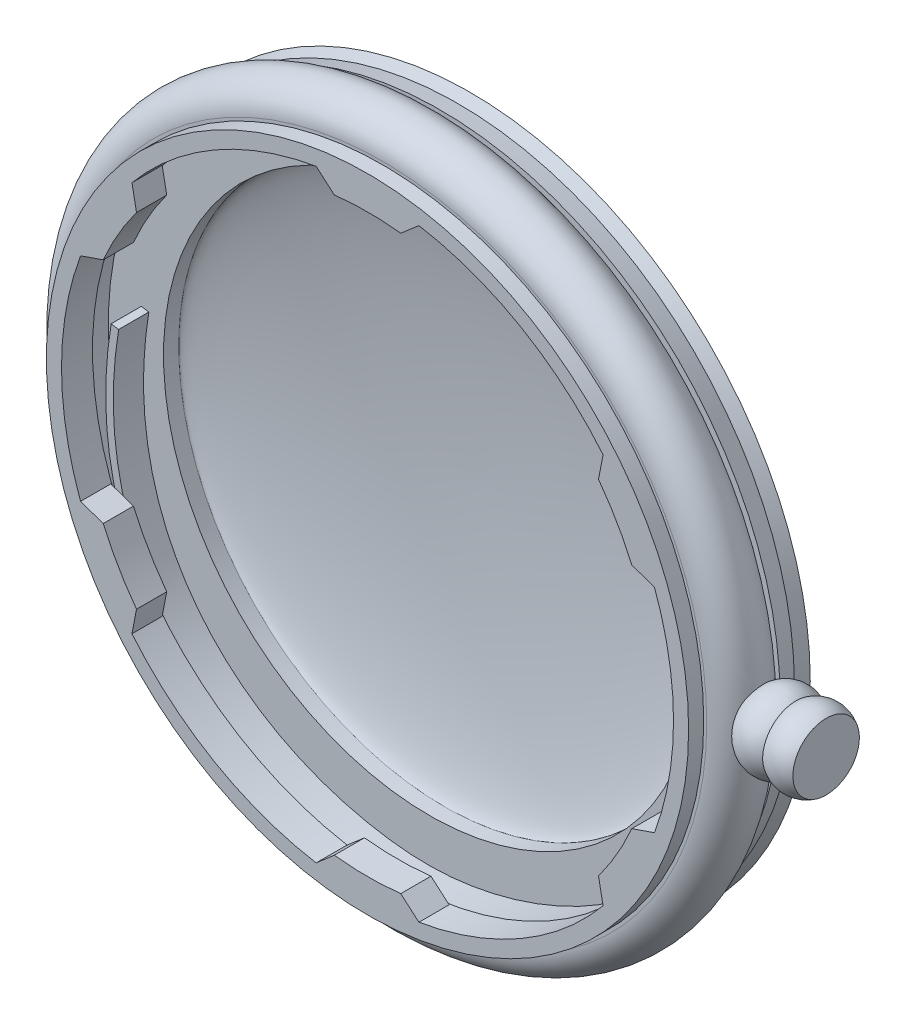
from build123d import *

# Parameters (mm, degrees)
EXTRUDE_1_DEPTH    = 2
EXTRUDE_1811_DEPTH = 2
EXTRUDE_1988_DEPTH = 2


# Read off the part's stored shape, not the designer's step: пружина
with BuildPart() as part:
    # Эскиз3 → Повернуть1 (revolve)
    with BuildSketch(Plane(origin=(0, 0, 0), x_dir=(1, 0, 0), z_dir=(0, 1, 0))):
        with BuildLine():
            Line((20.25, 0), (21.25, 0))
            Line((21.25, 0), (21.25, 1))
            Line((21.25, 1), (21.450000000000003, 1))
            ThreePointArc((21.450000000000003, 1), (23.35, 2.9), (21.450000000000003, 4.8))
            Line((21.450000000000003, 4.8), (22.5, 4.8))
            Line((22.5, 4.8), (22.249999999999996, 5.999999999999999))
            Line((22.249999999999996, 5.999999999999999), (22.5, 6.8))
            ThreePointArc((22.5, 6.8), (11.363208173750943, 9.195994971686233), (0, 10))
            Line((0, 10), (0, 7.5))
            add(Edge.make_bspline(
                [(17.6, 5.1), (17.68648321597052, 5.583837835157827), (11.760671311595946, 7.409355669392823), (0, 7.5)],
                knots=[0, 0, 0, 0, 1, 1, 1, 1], degree=3))
            Line((17.6, 5.1), (17.6, 4.099999999999999))
            Line((17.6, 4.099999999999999), (20.25, 4.099999999999999))
            Line((20.25, 4.099999999999999), (21.25, 4.099999999999999))
            Line((21.25, 4.099999999999999), (21.25, 2.0499999999999994))
            Line((21.25, 2.0499999999999994), (20.25, 2.0499999999999994))
            Line((20.25, 2.0499999999999994), (20.25, 0))
        make_face()
    revolve(axis=Axis((0, 0, 0), (0, 0, -1)))

    # Эскиз4 → Повернуть2 (revolve)
    with BuildSketch(Plane(origin=(0, 0, 0), x_dir=(0, 0, -1), z_dir=(0, 1, 0)), mode=Mode.PRIVATE) as revolve_2_sk:
        with BuildLine():
            Line((0.8000000000000034, -27.35), (3.0000000000000036, -27.35))
            Line((3.0000000000000036, -27.35), (3.0000000000000036, -22.729544095990384))
            Line((3.0000000000000036, -22.729544095990384), (1.4954477914950397, -22.729544095990384))
            ThreePointArc((1.4954477914950397, -22.729544095990384), (1.1072583055705365, -22.994415552653194), (0.8000000000000034, -23.35))
            ThreePointArc((0.8000000000000034, -23.35), (0.5000000000000051, -24.350000000000005), (0.8000000000000034, -25.350000000000005))
            ThreePointArc((0.8000000000000034, -25.350000000000005), (0.5000000000000056, -26.350000000000005), (0.8000000000000034, -27.35))
        make_face()
    revolve(revolve_2_sk.sketch.rotate(Axis((27.35, 0, -3.0000000000000036), (-1, 0, 0)), 180), axis=Axis((27.35, 0, -3.0000000000000036), (-1, 0, 0)))

    # Эскиз6 → Бобышка-Вытянуть1 (add)
    with BuildSketch(Plane.XY):
        with BuildLine():
            Line((-2.2, -18.922539470166264), (-3.4, -19.962527395097045))
            ThreePointArc((-3.4, -19.962527395097045), (1.24e-15, -20.25), (3.4, -19.962527395097045))
            Line((3.4, -19.962527395097045), (2.2, -18.922539470166264))
            ThreePointArc((2.2, -18.922539470166264), (1.17e-15, -19.050000000000004), (-2.2, -18.922539470166264))
        make_face()
        with BuildLine():
            Line((-15.28739988527774, -11.366525623408865), (-15.588055847896868, -12.925750070415583))
            ThreePointArc((-15.588055847896868, -12.925750070415583), (-17.537014426634908, -10.124999999999963), (-18.988055847896852, -7.036777324681391))
            Line((-18.988055847896852, -7.036777324681391), (-17.487399885277735, -7.556013846757328))
            ThreePointArc((-17.487399885277735, -7.556013846757328), (-16.497783942093584, -9.524999999999965), (-15.28739988527774, -11.366525623408865))
        make_face()
        with BuildLine():
            Line((-17.487399885277693, 7.556013846757449), (-18.988055847896817, 7.036777324681521))
            ThreePointArc((-18.988055847896817, 7.036777324681521), (-17.53701442663485, 10.125000000000083), (-15.588055847896788, 12.925750070415688))
            Line((-15.588055847896788, 12.925750070415688), (-15.287399885277672, 11.36652562340897))
            ThreePointArc((-15.287399885277672, 11.36652562340897), (-16.497783942093523, 9.525000000000087), (-17.487399885277693, 7.556013846757449))
        make_face()
        with BuildLine():
            Line((-2.1999999999998687, 18.922539470166274), (-3.3999999999998614, 19.96252739509707))
            ThreePointArc((-3.3999999999998614, 19.96252739509707), (1.4063e-13, 20.25), (3.400000000000138, 19.962527395097023))
            Line((3.400000000000138, 19.962527395097023), (2.2000000000001316, 18.92253947016625))
            ThreePointArc((2.2000000000001316, 18.92253947016625), (1.3229e-13, 19.05), (-2.1999999999998687, 18.922539470166274))
        make_face()
        with BuildLine():
            Line((15.287399885277813, 11.366525623408753), (15.58805584789695, 12.925750070415468))
            ThreePointArc((15.58805584789695, 12.925750070415468), (17.53701442663497, 10.124999999999838), (18.988055847896895, 7.036777324681256))
            Line((18.988055847896895, 7.036777324681256), (17.487399885277778, 7.556013846757204))
            ThreePointArc((17.487399885277778, 7.556013846757204), (16.49778394209364, 9.52499999999985), (15.287399885277813, 11.366525623408753))
        make_face()
        with BuildLine():
            Line((17.487399885277625, -7.55601384675757), (18.988055847896756, -7.036777324681652))
            ThreePointArc((18.988055847896756, -7.036777324681652), (17.53701442663477, -10.125000000000204), (15.588055847896687, -12.925750070415797))
            Line((15.588055847896687, -12.925750070415797), (15.287399885277582, -11.366525623409075))
            ThreePointArc((15.287399885277582, -11.366525623409075), (16.497783942093445, -9.52500000000019), (17.487399885277625, -7.55601384675757))
        make_face()
    extrude(amount=-EXTRUDE_1_DEPTH)


with BuildPart() as body_2:
    # Extrude 1811 outline → Extrude 1811 (new body)
    with BuildSketch(Plane.XY.offset(-4.099999999999999)):
        with BuildLine():
            Line((-18.571936423, 1.971918763), (-19.065403762, 2.052479209))
            add(Edge.make_bspline(
                [(-19.065403762, 2.052479209), (-19.5608168488982, -0.982138754343007), (-19.5289875725156, -3.74715756678371), (-18.5829798934297, -8.70402014463167), (-17.6681740511601, -10.8950314599481), (-15.1452997626881, -14.657462235248), (-13.5381887525688, -16.2283170155345), (-9.83508618174293, -18.721900143671), (-7.73935639577416, -19.6452755858668), (-4.93491023286923, -20.3856470306141), (-4.36475543627115, -20.5130328985695), (-3.20883686791784, -20.7261834053054), (-2.62317028558831, -20.8129043899692), (-0.821806580127363, -20.9956157365632), (0.436839580527143, -21.0126468689093), (2.47738891240008, -20.8022281628961), (3.18550462308288, -20.6921642905461), (4.64481731746651, -20.3864905165527), (5.39466991149929, -20.1912898588091), (7.67052292630654, -19.4738461288268), (9.22297257444626, -18.8198657154798), (12.2107189598901, -17.1319774941594), (13.6461529796485, -16.0979257899178), (16.2053537619806, -13.6189879292943), (17.3290438798867, -12.1735499646399), (19.0598614969327, -8.84838748586538), (19.666072598016, -6.96885118670048), (20.161387122414, -2.77158072536785), (20.0508287060798, -0.454865816939449), (19.491983625, 2.084957609)],
                knots=[0, 0, 0, 0, 0.125, 0.125, 0.25, 0.25, 0.375, 0.375, 0.5, 0.5, 0.53125, 0.53125, 0.5625, 0.5625, 0.625, 0.625, 0.65625, 0.65625, 0.6875, 0.6875, 0.75, 0.75, 0.8125, 0.8125, 0.875, 0.875, 0.9375, 0.9375, 1, 1, 1, 1], degree=3))
            Line((19.491983625, 2.084957609), (19.003664778, 1.977511327))
            add(Edge.make_bspline(
                [(-18.571936423, 1.971918763), (-20.6643253902591, -10.8448624589785), (-11.7567916507723, -19.9473001190712), (7.22272099149138, -20.9638051634758), (22.1874596075476, -12.4921099734157), (19.003664778, 1.977511327)],
                knots=[0, 0, 0, 0, 0.536963763998546, 0.636963763998546, 1, 1, 1, 1], degree=3))
        make_face()
    extrude(amount=EXTRUDE_1811_DEPTH)

    # Эскиз8 → Extrude 1988 (add)
    with BuildSketch(Plane.XY.offset(-2.0999999999999988)):
        with BuildLine():
            add(Edge.make_bspline(
                [(19.00366477765303, 1.977511326728632), (19.526518131814505, -0.02531023876852211), (19.52564554450298, -1.9997204689170207)],
                knots=[0, 0, 0, 1, 1, 1], degree=2))
            add(Edge.make_bspline(
                [(19.52564554450298, -1.9997204689170207), (17.898847867822333, -0.5761912037183654), (17.4004310622032, 0.6084296537456167), (19.00366477765303, 1.977511326728632)],
                knots=[0, 0, 0, 0, 1, 1, 1, 1], degree=3))
        make_face()
    extrude(amount=-EXTRUDE_1988_DEPTH)


solid = Compound([part.part, body_2.part])
